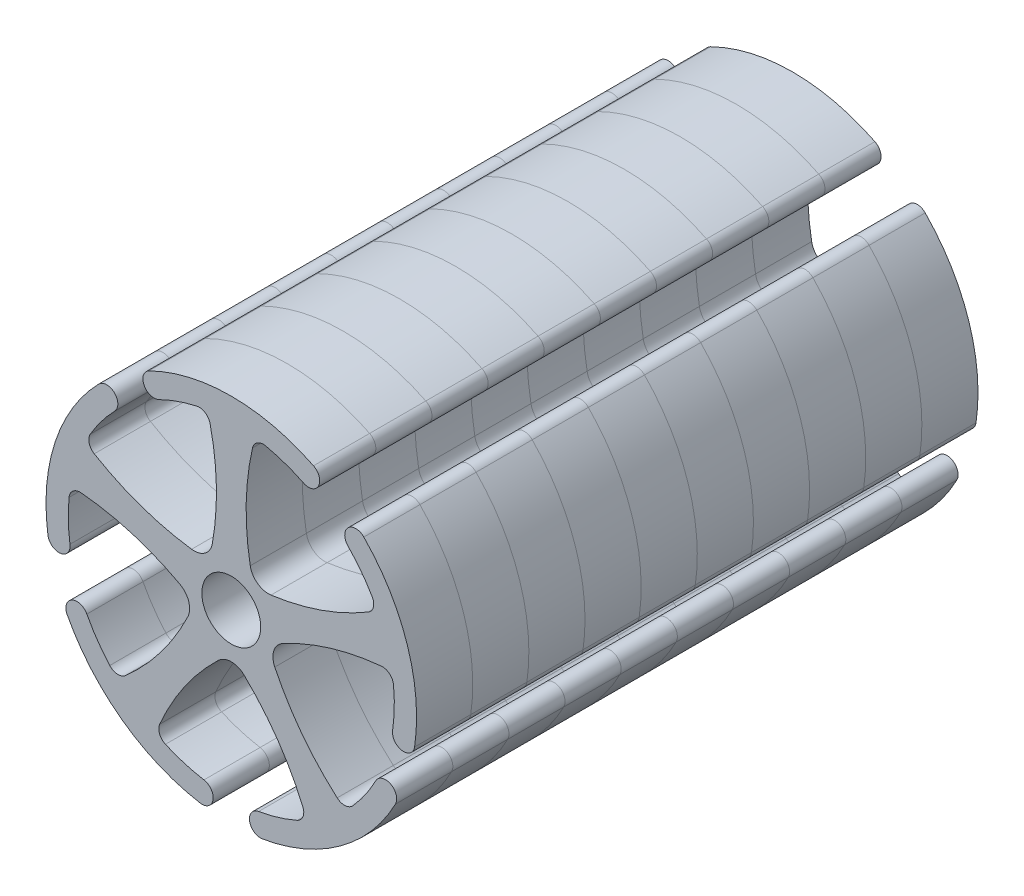
from build123d import *
from OCP.BRepFilletAPI import BRepFilletAPI_MakeFillet

# Parameters (mm, degrees)
BOSS_EXTRUDE3_DEPTH = 3.03
CIRPATTERN1_COUNT   = 5
SKETCH6_R           = 1.5875
CUT_EXTRUDE1_DEPTH  = 82
FILLET1_R1          = 1
FILLET1_R2          = 0.6
LPATTERN1_COUNT     = 10
LPATTERN1_PITCH     = 3.03


with BuildPart() as part:
    # Sketch2 → Boss-Extrude3 (new body)
    with BuildSketch(Plane.XY):
        with BuildLine():
            Line((-1.754642488, 0), (1.754642488, 0))
            ThreePointArc((1.754642488, 0), (0.820600043, 4.315154407), (1.283219684, 8.705937471))
            ThreePointArc((1.283219684, 8.705937471), (2.626309951, 8.398958033), (3.905026871, 7.886112168))
            ThreePointArc((3.905026871, 7.886112168), (4.70896817, 8.157549802), (4.437530536, 8.961491101))
            ThreePointArc((4.437530536, 8.961491101), (0, 10), (-4.437530536, 8.961491101))
            ThreePointArc((-4.437530536, 8.961491101), (-4.70896817, 8.157549802), (-3.905026871, 7.886112168))
            ThreePointArc((-3.905026871, 7.886112168), (-2.626309951, 8.398958033), (-1.283219684, 8.705937471))
            ThreePointArc((-1.283219684, 8.705937471), (-0.820600043, 4.315154407), (-1.754642488, 0))
        make_face()
    extrude(amount=-BOSS_EXTRUDE3_DEPTH)

    # CirPattern1: part ×5 about axis
    cirpattern1_axis = Axis((0, 0, 0), (0, 0, -1))


with BuildPart() as part_1:
    add(part.part)
    for i in range(1, CIRPATTERN1_COUNT):
        add(part.part.rotate(cirpattern1_axis, i * 360 / CIRPATTERN1_COUNT))

    # Sketch6 → Cut-Extrude1 (cut)
    with BuildSketch(Plane(origin=(0, 0, -3.03), x_dir=(-1, 0, 0), z_dir=(0, 0, -1))):
        Circle(SKETCH6_R)
    extrude(amount=-CUT_EXTRUDE1_DEPTH, mode=Mode.SUBTRACT)

    # Fillet1: one fillet with a radius per group of edges: ONE call of the kernel's fillet builder (fillet() takes one radius for all edges)
    fillet1_edges_1 = [part_1.edges().sort_by_distance(p)[0] for p in [
        (-1.219020394, 1.67783763, -1.515),
        (-1.97241643, -0.640876947, -1.515),
        (0, -2.073921366, -1.515),
        (1.97241643, -0.640876947, -1.515),
        (1.219020394, 1.67783763, -1.515),
    ]]
    fillet1_edges_2 = [part_1.edges().sort_by_distance(p)[0] for p in [
        (-1.283219684, 8.705937471, -1.515),
        (1.283219684, 8.705937471, -1.515),
        (-7.883301872, 3.910697072, -1.515),
        (-8.676375252, 1.469868188, -1.515),
        (-6.155368184, -6.28899376, -1.515),
        (6.155368184, -6.28899376, -1.515),
        (-4.079075121, -7.797508971, -1.515),
        (4.079075121, -7.797508971, -1.515),
        (8.676375252, 1.469868188, -1.515),
        (7.883301872, 3.910697072, -1.515),
    ]]
    fillet1 = BRepFilletAPI_MakeFillet(part_1.part.solid().wrapped)
    for e in fillet1_edges_1:
        fillet1.Add(FILLET1_R1, e.wrapped)
    for e in fillet1_edges_2:
        fillet1.Add(FILLET1_R2, e.wrapped)
    add(Compound.cast(fillet1.Shape()), mode=Mode.REPLACE)


with BuildPart() as lpattern1_1:
    # LPattern1: pattern copy
    add(part_1.part.moved(Location(Vector(0, 0, 1) * (1 * LPATTERN1_PITCH))))


with BuildPart() as lpattern1_2:
    # LPattern1: pattern copy
    add(part_1.part.moved(Location(Vector(0, 0, 1) * (2 * LPATTERN1_PITCH))))


with BuildPart() as lpattern1_3:
    # LPattern1: pattern copy
    add(part_1.part.moved(Location(Vector(0, 0, 1) * (3 * LPATTERN1_PITCH))))


with BuildPart() as lpattern1_4:
    # LPattern1: pattern copy
    add(part_1.part.moved(Location(Vector(0, 0, 1) * (4 * LPATTERN1_PITCH))))


with BuildPart() as lpattern1_5:
    # LPattern1: pattern copy
    add(part_1.part.moved(Location(Vector(0, 0, 1) * (5 * LPATTERN1_PITCH))))


with BuildPart() as lpattern1_6:
    # LPattern1: pattern copy
    add(part_1.part.moved(Location(Vector(0, 0, 1) * (6 * LPATTERN1_PITCH))))


with BuildPart() as lpattern1_7:
    # LPattern1: pattern copy
    add(part_1.part.moved(Location(Vector(0, 0, 1) * (7 * LPATTERN1_PITCH))))


with BuildPart() as lpattern1_8:
    # LPattern1: pattern copy
    add(part_1.part.moved(Location(Vector(0, 0, 1) * (8 * LPATTERN1_PITCH))))


with BuildPart() as lpattern1_9:
    # LPattern1: pattern copy
    add(part_1.part.moved(Location(Vector(0, 0, 1) * (9 * LPATTERN1_PITCH))))


solid = Compound([part_1.part, lpattern1_1.part, lpattern1_2.part, lpattern1_3.part, lpattern1_4.part, lpattern1_5.part, lpattern1_6.part, lpattern1_7.part, lpattern1_8.part, lpattern1_9.part])
